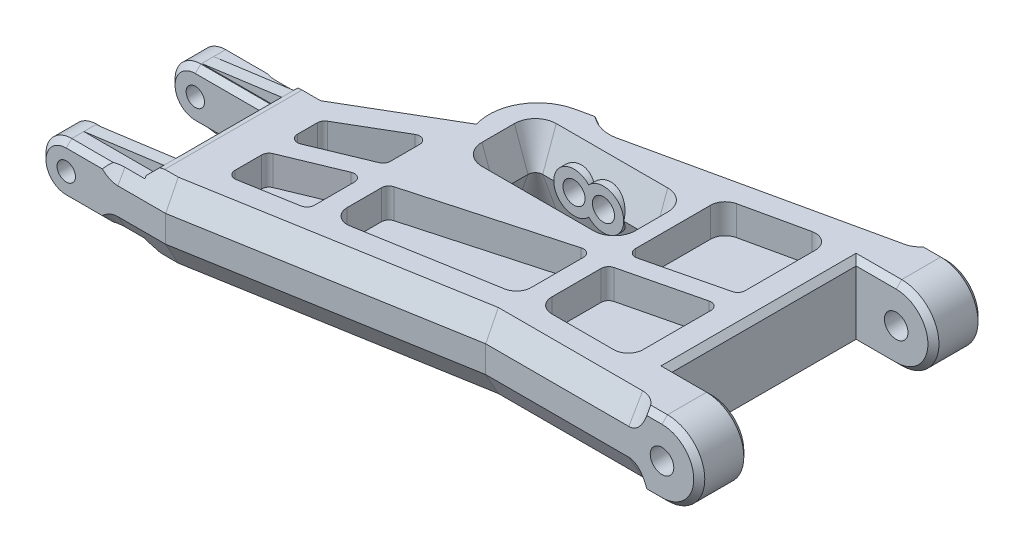
from build123d import *

# Parameters (mm, degrees)
BOSS_EXTRUDE1_DEPTH          = 22.5
SKETCH2_W                    = 5.44
SKETCH2_H                    = 25
SKETCH2_W_2                  = 5.06
SKETCH2_W_3                  = 14
SKETCH2_H_2                  = 12.66
CUT_EXTRUDE1_DEPTH           = 84.297406922
CUT_EXTRUDE2_DEPTH           = 4
CUT_EXTRUDE3_DEPTH           = 83.83506021
CUT_EXTRUDE3_TAPER           = -20
CUT_EXTRUDE3_OTHER_WAY_DEPTH = 83.83506021
CUT_EXTRUDE3_OTHER_WAY_TAPER = -20
SKETCH5_R                    = 1.25
CUT_EXTRUDE4_DEPTH           = 83.862278517
SKETCH6_R                    = 1.6
CUT_EXTRUDE5_DEPTH           = 92.544509398
CHAMFER1_SIZE                = 1.876388375
CHAMFER1_SIZE_2              = 3.25
CHAMFER4_SIZE                = 1.876388375
CHAMFER4_SIZE_2              = 3.25
SKETCH7_W                    = 13.2
SKETCH7_H                    = 1.292571429
CUT_EXTRUDE6_DEPTH           = 92.544509398
CHAMFER3_SIZE                = 1
CHAMFER3_SIZE2               = 1.187388498
BOSS_EXTRUDE2_REACH          = 90.574
BOSS_EXTRUDE3_REACH          = 93.545
FILLET1_R                    = 3
SKETCH10_R                   = 2.75
BOSS_EXTRUDE4_DEPTH          = 3.1
SKETCH11_R                   = 1.5
CUT_EXTRUDE7_DEPTH           = 5
BOSS_EXTRUDE5_REACH          = 85.297
FILLET2_R                    = 5
CUT_EXTRUDE8_DEPTH           = 5
EXTRUDE_THIN1_DEPTH          = 0.815
BOSS_EXTRUDE6_START          = -0.975722
BOSS_EXTRUDE6_DEPTH          = 0.975722
BOSS_EXTRUDE7_START          = -0.975722
BOSS_EXTRUDE7_DEPTH          = 0.975722
FILLET3_R                    = 5
FILLET4_R                    = 2
FILLET5_R                    = 1
CHAMFER5_SIZE                = 0.75
SKETCH20_R                   = 94.398541258
CUT_EXTRUDE10_DEPTH          = 83.835060221


with BuildPart() as part:
    # Sketch1 → Boss-Extrude1 (new, symmetric)
    with BuildSketch(Plane.XY):
        with BuildLine():
            Line((11.5, 5.06), (1, 3.5))
            Line((1, 3.5), (0, 3.5))
            ThreePointArc((0, 3.5), (-3.5, 0), (0, -3.5))
            Line((0, -3.5), (1, -3.5))
            Line((1, -3.5), (11.5, -5.06))
            Line((11.5, -5.06), (74.5, -5.06))
            ThreePointArc((74.5, -5.06), (79.56, 0), (74.5, 5.06))
            Line((74.5, 5.06), (11.5, 5.06))
        make_face()
    extrude(amount=BOSS_EXTRUDE1_DEPTH, both=True)

    # Sketch2 → Cut-Extrude1 (cut, through all)
    with BuildSketch(Plane(origin=(0, 5.06, 0), x_dir=(1, 0, 0), z_dir=(0, 1, 0))):
        with Locations((71.78, 3.2)):
            Rectangle(SKETCH2_W, SKETCH2_H)
        with Locations((77.03, 3.2)):
            Rectangle(SKETCH2_W_2, SKETCH2_H)
        with BuildLine():
            Line((13.5, -0.1), (27.06, 7.841716136))
            ThreePointArc((27.06, 7.841716136), (28.519247904, 11.985264581), (32.252932157, 14.3))
            Line((32.252932157, 14.3), (69.56, 22.5))
            Line((69.56, 22.5), (-4.3, 22.5))
            Line((-4.3, 22.5), (-4.3, -0.1))
            Line((-4.3, -0.1), (13.5, -0.1))
        make_face()
        with Locations((2.7, -11.3)):
            Rectangle(SKETCH2_W_3, SKETCH2_H_2)
        Polygon((79.56, -22.5), (13.5, -22.5), (50.56, -16.1), (79.56, -16.1), align=None)
    extrude(amount=-CUT_EXTRUDE1_DEPTH, mode=Mode.SUBTRACT)

    # Sketch3 → Cut-Extrude2 (cut)
    with BuildSketch(Plane(origin=(0, 5.06, 0), x_dir=(1, 0, 0), z_dir=(0, 1, 0))):
        Polygon((16.38, -17.182335448), (16.38, -11.682335448), (25.88, -7.741752609), (25.88, -15.541752609), align=None)
        Polygon((16.38, -4.207683605), (25.88, 1.356203069), (25.88, -5.03521245), (16.38, -8.975795289), align=None)
        Polygon((52.78, -11.35), (65.18, -11.35), (65.18, 1.15), (52.78, -1.85), align=None)
        Polygon((65.18, 16.540798611), (52.78, 13.815309693), (52.78, 0.722125554), (65.18, 3.722125554), align=None)
        Polygon((28.38, -15.110020283), (50.28, -11.328045108), (50.28, -1.228045108), (28.38, -7.310020283), align=None)
    extrude(amount=-CUT_EXTRUDE2_DEPTH, mode=Mode.SUBTRACT)

    # Sketch4 → Cut-Extrude3 (cut)
    with BuildSketch(Plane(origin=(0, 0, 0), x_dir=(1, 0, 0), z_dir=(0, 1, 0))):
        with BuildLine():
            ThreePointArc((32.7, 9.5), (31.992893219, 9.207106781), (31.7, 8.5))
            Line((31.7, 8.5), (31.7, 4.1))
            ThreePointArc((31.7, 4.1), (31.992893219, 3.392893219), (32.7, 3.1))
            Line((32.7, 3.1), (47.83, 3.1))
            ThreePointArc((47.83, 3.1), (48.537106781, 3.392893219), (48.83, 4.1))
            Line((48.83, 4.1), (48.83, 8.5))
            ThreePointArc((48.83, 8.5), (48.537106781, 9.207106781), (47.83, 9.5))
            Line((47.83, 9.5), (32.7, 9.5))
        make_face()
    extrude(amount=-CUT_EXTRUDE3_DEPTH, taper=CUT_EXTRUDE3_TAPER, mode=Mode.SUBTRACT)

    # Sketch4 → Cut-Extrude3 other way (cut)
    with BuildSketch(Plane(origin=(0, 0, 0), x_dir=(1, 0, 0), z_dir=(0, 1, 0))):
        with BuildLine():
            ThreePointArc((32.7, 9.5), (31.992893219, 9.207106781), (31.7, 8.5))
            Line((31.7, 8.5), (31.7, 4.1))
            ThreePointArc((31.7, 4.1), (31.992893219, 3.392893219), (32.7, 3.1))
            Line((32.7, 3.1), (47.83, 3.1))
            ThreePointArc((47.83, 3.1), (48.537106781, 3.392893219), (48.83, 4.1))
            Line((48.83, 4.1), (48.83, 8.5))
            ThreePointArc((48.83, 8.5), (48.537106781, 9.207106781), (47.83, 9.5))
            Line((47.83, 9.5), (32.7, 9.5))
        make_face()
    extrude(amount=CUT_EXTRUDE3_OTHER_WAY_DEPTH, taper=CUT_EXTRUDE3_OTHER_WAY_TAPER, mode=Mode.SUBTRACT)

    # Sketch5 → Cut-Extrude4 (cut, through all)
    with BuildSketch(Plane(origin=(0, 0, 0.1), x_dir=(-1, 0, 0), z_dir=(0, 0, -1))):
        Circle(SKETCH5_R)
    extrude(amount=-CUT_EXTRUDE4_DEPTH, mode=Mode.SUBTRACT)

    # Sketch6 → Cut-Extrude5 (cut, through all)
    with BuildSketch(Plane(origin=(0, 0, -22.5), x_dir=(-1, 0, 0), z_dir=(0, 0, -1))):
        with Locations((-74.5, 0)):
            Circle(SKETCH6_R)
    extrude(amount=-CUT_EXTRUDE5_DEPTH, mode=Mode.SUBTRACT)

    # Chamfer1
    # the kernel refuses this chamfer: 3.25, 1.876388375 mm, written as the material it takes off along each edge
    with BuildSketch(Plane(origin=(24.040928635, 5.06, -12.49502221), x_dir=(0.21467312424098708, 1.4200339837909367e-15, 0.9766859524579095), z_dir=(0.9766859524579095, 0, -0.21467312424098706))) as chamfer1_piece_1:
        Polygon((CHAMFER1_SIZE, 0), (0, CHAMFER1_SIZE_2), (0, 0), align=None)
    extrude(amount=60.899286206, mode=Mode.SUBTRACT)
    with BuildSketch(Plane(origin=(6.244719032, 5.06, 4.349216957), x_dir=(0.505376124050371, 2.840067967581874e-15, 0.862899167481244), z_dir=(0.862899167481244, 0, -0.5053761240503711))) as chamfer1_piece_2_section:
        Polygon((CHAMFER1_SIZE, 0), (0, CHAMFER1_SIZE_2), (0, 0), align=None)
    chamfer1_piece_2 = extrude(amount=32.530523835, mode=Mode.PRIVATE)
    chamfer1_piece_2 = chamfer1_piece_2 - Plane(origin=(33.672446762, 5.06, -7.841716136), x_dir=(-1, 0, 0), z_dir=(0, 1, 0)) * Cylinder(6.612446762, 79, mode=Mode.PRIVATE)
    chamfer1_piece_2 = split(chamfer1_piece_2, bisect_by=Plane(origin=(6.244719032, 6.087464915, 2.56959552), z_dir=(0, 0.5000000000000003, -0.8660254037844385)), keep=Keep.TOP, mode=Mode.PRIVATE)
    add(chamfer1_piece_2, mode=Mode.SUBTRACT)
    with BuildSketch(Plane(origin=(-13.724086108, 5.06, 0.1), x_dir=(0, 0, 1), z_dir=(1, 0, 0))) as chamfer1_piece_3_section:
        Polygon((CHAMFER1_SIZE, 0), (0, CHAMFER1_SIZE_2), (0, 0), align=None)
    chamfer1_piece_3 = extrude(amount=35.63211481, mode=Mode.PRIVATE)
    chamfer1_piece_3 = split(chamfer1_piece_3, bisect_by=Plane(origin=(-7.797998364, -1.710063308, 10.218436422), z_dir=(-0.4376685618937373, 0.4999999999999999, -0.7472925999432003)), keep=Keep.TOP, mode=Mode.PRIVATE)
    add(chamfer1_piece_3, mode=Mode.SUBTRACT)

    # Chamfer4
    # the kernel refuses this chamfer: 3.25, 1.876388375 mm, written as the material it takes off along each edge
    with BuildSketch(Plane(origin=(42.151971297, 5.06, 16.1), x_dir=(0, 0, -1), z_dir=(1, 0, 0))) as chamfer4_piece_1_section:
        Polygon((CHAMFER4_SIZE, 0), (0, -CHAMFER4_SIZE_2), (0, 0), align=None)
    chamfer4_piece_1 = extrude(amount=40.756057405, mode=Mode.PRIVATE)
    chamfer4_piece_1 = split(chamfer4_piece_1, bisect_by=Plane(origin=(42.095104214, 4.867066773, 15.770704047), z_dir=(0.14737503768376764, 0.5000000000000004, 0.8533935775875676)), keep=Keep.TOP, mode=Mode.PRIVATE)
    add(chamfer4_piece_1, mode=Mode.SUBTRACT)
    with BuildSketch(Plane(origin=(-0.585161969, 5.06, 24.932407895), x_dir=(-0.170174035357109, 2.3667233063182273e-15, -0.98541402348976), z_dir=(0.98541402348976, 0, -0.170174035357109))) as chamfer4_piece_2_section:
        Polygon((CHAMFER4_SIZE, 0), (0, -CHAMFER4_SIZE_2), (0, 0), align=None)
    chamfer4_piece_2 = extrude(amount=60.310235034, mode=Mode.PRIVATE)
    chamfer4_piece_2 = split(chamfer4_piece_2, bisect_by=Plane(origin=(-0.585161969, 0.422955193, 16.900810693), z_dir=(0, 0.5000000000000011, 0.866025403784438)), keep=Keep.TOP, mode=Mode.PRIVATE)
    add(chamfer4_piece_2, mode=Mode.SUBTRACT)
    with BuildSketch(Plane(origin=(27.793648794, 5.06, 22.5), x_dir=(0, 0, -1), z_dir=(-1, 0, 0))) as chamfer4_piece_3:
        Polygon((CHAMFER4_SIZE, 0), (0, CHAMFER4_SIZE_2), (0, 0), align=None)
    extrude(amount=41.517734902, mode=Mode.SUBTRACT)

    # Sketch7 → Cut-Extrude6 (cut, through all)
    with BuildSketch(Plane.XY.offset(22.5)):
        with Locations((3.1, 4.146285715)):
            Rectangle(SKETCH7_W, SKETCH7_H)
    extrude(amount=-CUT_EXTRUDE6_DEPTH, mode=Mode.SUBTRACT)

    # Chamfer3
    chamfer3_edges = [part.edges().sort_by_distance(p)[0] for p in [
        (9.7, 4.792571429, 11.3),
    ]]
    chamfer3_side = [part.faces().sort_by_distance(p)[0] for p in [
        (9.7, 0.287729181, 11.3),
    ]]
    chamfer(chamfer3_edges, length=CHAMFER3_SIZE, length2=CHAMFER3_SIZE2, reference=chamfer3_side[0])

    # Boss-Extrude2: up to this face of the body (flat: up to its plane)
    boss_extrude2_end = Plane(part.part.faces().sort_by_distance((64.226118544, 3.401483024, 15.181156848))[0])
    # Sketch8 → Boss-Extrude2 (add, up to the picked face)
    with BuildSketch(Plane.XY.offset(16.1), mode=Mode.PRIVATE) as boss_extrude2_sk1:
        with BuildLine():
            Line((73, 1.81), (79.225198409, 1.81))
            ThreePointArc((79.225198409, 1.81), (77.367490192, 4.169064643), (74.5, 5.06))
            Line((74.5, 5.06), (73, 5.06))
            Line((73, 5.06), (73, 1.81))
        make_face()
    boss_extrude2_tool1 = split(extrude(boss_extrude2_sk1.sketch, amount=-BOSS_EXTRUDE2_REACH, mode=Mode.PRIVATE), bisect_by=boss_extrude2_end, keep=Keep.BOTH, mode=Mode.PRIVATE)
    add(boss_extrude2_tool1.solids().sort_by(Axis((75.582426, 3.239563, 16.1), (0, 0, -1)))[0])

    # Boss-Extrude3: up to this face of the body (flat: up to its plane)
    boss_extrude3_end = Plane(part.part.faces().sort_by_distance((51.558145172, 3.49910555, -17.544753178))[0])
    # Sketch9 → Boss-Extrude3 (add, up to the picked face)
    with BuildSketch(Plane(origin=(0, 0, -22.5), x_dir=(-1, 0, 0), z_dir=(0, 0, -1)), mode=Mode.PRIVATE) as boss_extrude3_sk1:
        with BuildLine():
            Line((-76.805719419, 4.504137871), (-73, 3.089077168))
            Line((-73, 3.089077168), (-73, 5.06))
            Line((-73, 5.06), (-74.5, 5.06))
            ThreePointArc((-74.5, 5.06), (-75.685888353, 4.919071946), (-76.805719419, 4.504137871))
        make_face()
    boss_extrude3_tool1 = split(extrude(boss_extrude3_sk1.sketch, amount=-BOSS_EXTRUDE3_REACH, mode=Mode.PRIVATE), bisect_by=boss_extrude3_end, keep=Keep.BOTH, mode=Mode.PRIVATE)
    add(boss_extrude3_tool1.solids().sort_by(Axis((74.387172, 4.311631, -22.5), (0, 0, 1)))[0])

    # Fillet1
    # the kernel refuses this fillet: 3 mm, written as the material it adds along each edge
    with BuildSketch(Plane(origin=(73, 10.409266488, -18.172802231), x_dir=(-0.9825663271747567, -0.0946055110822194, 0.16004127584839264), z_dir=(0, -0.8608424927047637, -0.5088714992548207))) as fillet1_piece_1_section:
        with BuildLine():
            CenterArc((FILLET1_R * 0.828531976301, FILLET1_R), FILLET1_R, 190.714330728, 79.285669272)
            Line((-FILLET1_R * 0.154034350874, FILLET1_R * 0.814087620901), (0, 0))
            Line((0, 0), (FILLET1_R * 0.828531976301, 0))
        make_face()
    fillet1_piece_1 = extrude(amount=14.71750746, mode=Mode.PRIVATE)
    fillet1_piece_1 = split(fillet1_piece_1, bisect_by=Plane(origin=(73, 10.409266488, -22.5), z_dir=(0, 0, 1)), keep=Keep.TOP, mode=Mode.PRIVATE)
    fillet1_piece_1 = split(fillet1_piece_1, bisect_by=Plane(origin=(73, 5.06, -18.172802231), z_dir=(0, -1, 0)), keep=Keep.TOP, mode=Mode.PRIVATE)
    add(fillet1_piece_1)
    with BuildSketch(Plane(origin=(73, -4.685190528, 19.85), x_dir=(0, 0.5000000000267207, 0.8660254037690114), z_dir=(0, 0.8660254037690115, -0.5000000000267208))) as fillet1_piece_2_section:
        with BuildLine():
            CenterArc((FILLET1_R, -FILLET1_R), FILLET1_R, 90, 90)
            Line((0, -FILLET1_R), (0, 0))
            Line((0, 0), (FILLET1_R, 0))
        make_face()
    fillet1_piece_2 = extrude(amount=18.75277675, mode=Mode.PRIVATE)
    fillet1_piece_2 = split(fillet1_piece_2, bisect_by=Plane(origin=(73, -4.685190528, 16.1), z_dir=(0, 0, -1)), keep=Keep.TOP, mode=Mode.PRIVATE)
    fillet1_piece_2 = split(fillet1_piece_2, bisect_by=Plane(origin=(73, 5.06, 19.85), z_dir=(0, -1, 0)), keep=Keep.TOP, mode=Mode.PRIVATE)
    add(fillet1_piece_2)

    # Sketch10 → Boss-Extrude4 (add)
    with BuildSketch(Plane.XY):
        with Locations((36.951639785, 0)):
            Circle(SKETCH10_R)
        with Locations((40.951639785, 0)):
            Circle(SKETCH10_R)
    boss_extrude4 = extrude(amount=-BOSS_EXTRUDE4_DEPTH)

    # Sketch11 → Cut-Extrude7 (cut)
    with BuildSketch(Plane(origin=(0, 0, -3.1), x_dir=(-1, 0, 0), z_dir=(0, 0, -1))):
        with Locations((-36.951639785, 0)):
            Circle(SKETCH11_R)
        with Locations((-40.951639785, 0)):
            Circle(SKETCH11_R)
    cut_extrude7 = extrude(amount=-CUT_EXTRUDE7_DEPTH, mode=Mode.SUBTRACT)

    # Mirror2: Boss-Extrude4, Cut-Extrude7 across plane
    add(boss_extrude4.mirror(Plane(origin=(0, 0, -6.3), x_dir=(1, 0, 0), z_dir=(0, 0, -1))))
    add(cut_extrude7.mirror(Plane(origin=(0, 0, -6.3), x_dir=(1, 0, 0), z_dir=(0, 0, -1))), mode=Mode.SUBTRACT)

    # Boss-Extrude5: up to this face of the body (flat: up to its plane)
    boss_extrude5_end = Plane(part.part.faces().sort_by_distance((49.916496452, 3.457626238, -17.208442651))[0])
    # Sketch17 → Boss-Extrude5 (add, up to the picked face)
    with BuildSketch(Plane(origin=(0, 5.06, 0), x_dir=(1, 0, 0), z_dir=(0, 1, 0)), mode=Mode.PRIVATE) as boss_extrude5_sk1:
        with BuildLine():
            Line((33.632428264, 12.682030957), (33.229618109, 14.514673124))
            Line((33.229618109, 14.514673124), (32.252932157, 14.3))
            ThreePointArc((32.252932157, 14.3), (29.924819517, 13.289627865), (28.148762241, 11.47673491))
            Line((28.148762241, 11.47673491), (33.632428264, 12.682030957))
        make_face()
    boss_extrude5_tool1 = split(extrude(boss_extrude5_sk1.sketch, amount=-BOSS_EXTRUDE5_REACH, mode=Mode.PRIVATE), bisect_by=boss_extrude5_end, keep=Keep.BOTH, mode=Mode.PRIVATE)
    add(boss_extrude5_tool1.solids().sort_by(Axis((31.286541, 5.06, -12.988637), (0, -1, 0)))[0])

    # Fillet2
    # the kernel refuses this fillet: 5 mm, written as the material it adds along each edge
    with BuildSketch(Plane(origin=(31.887911083, -9.015317547, -20.618960327), x_dir=(0.9766859524579098, -1.874984630311798e-15, -0.21467312424098514), z_dir=(0.10733656212623062, 0.8660254037690109, 0.48834297625505346))) as fillet2_piece_1_section:
        with BuildLine():
            CenterArc((FILLET2_R, FILLET2_R), FILLET2_R, 180, 90)
            Line((0, FILLET2_R), (0, 0))
            Line((0, 0), (FILLET2_R, 0))
        make_face()
    fillet2_piece_1 = extrude(amount=28.75277675, mode=Mode.PRIVATE)
    fillet2_piece_1 = split(fillet2_piece_1, bisect_by=Plane(origin=(31.887911083, 5.06, -20.618960327), z_dir=(0, -1, 0)), keep=Keep.TOP, mode=Mode.PRIVATE)
    fillet2_piece_1 = split(fillet2_piece_1, bisect_by=Plane(origin=(33.229618109, -9.015317547, -14.514673124), z_dir=(0.21467312424098706, 0, 0.9766859524579095)), keep=Keep.TOP, mode=Mode.PRIVATE)
    add(fillet2_piece_1)

    # Sketch12 → Cut-Extrude8 (cut)
    with BuildSketch(Plane.XY.offset(-13.5)):
        with BuildLine():
            Line((36.951639785, 2.95), (40.951639785, 2.95))
            ThreePointArc((40.951639785, 2.95), (43.901639785, 0), (40.951639785, -2.95))
            Line((40.951639785, -2.95), (36.951639785, -2.95))
            ThreePointArc((36.951639785, -2.95), (34.001639785, 0), (36.951639785, 2.95))
        make_face()
    extrude(amount=-CUT_EXTRUDE8_DEPTH, mode=Mode.SUBTRACT)

    # Sketch13 → Extrude-Thin1 (add, symmetric)
    with BuildSketch(Plane.XY.offset(19.3)):
        Polygon((0, 3.5), (10.874496644, 4.967068073), (11.141892366, 2.985023793), (0.267395722, 1.51795572), align=None)
    extrude_thin1 = extrude(amount=EXTRUDE_THIN1_DEPTH, both=True)

    # Sketch18 → Boss-Extrude6 (add)
    with BuildSketch(Plane.XY.offset(22.5).offset(BOSS_EXTRUDE6_START)):
        with BuildLine():
            Line((2, 1.81), (2, 3.5))
            Line((2, 3.5), (0, 3.5))
            ThreePointArc((0, 3.5), (-1.719738352, 3.048360215), (-2.995646842, 1.81))
            Line((-2.995646842, 1.81), (2, 1.81))
        make_face()
    extrude(amount=BOSS_EXTRUDE6_DEPTH)

    # Sketch19 → Boss-Extrude7 (add)
    with BuildSketch(Plane(origin=(0, 0, 0.1), x_dir=(-1, 0, 0), z_dir=(0, 0, -1)).offset(BOSS_EXTRUDE7_START)):
        with BuildLine():
            Line((0, 3.5), (-2, 3.5))
            Line((-2, 3.5), (-2, 1.81))
            Line((-2, 1.81), (2.995646842, 1.81))
            ThreePointArc((2.995646842, 1.81), (1.719738352, 3.048360215), (0, 3.5))
        make_face()
    extrude(amount=BOSS_EXTRUDE7_DEPTH)

    # Fillet3
    # the kernel refuses this fillet: 5 mm, written as the material it adds along each edge
    with BuildSketch(Plane(origin=(2, 14.325317625, 15.274278), x_dir=(1, 0, 0), z_dir=(0, -0.8660254037690098, 0.5000000000267235))) as fillet3_piece_1_section:
        with BuildLine():
            CenterArc((FILLET3_R, FILLET3_R), FILLET3_R, 180, 90)
            Line((0, FILLET3_R), (0, 0))
            Line((0, 0), (FILLET3_R, 0))
        make_face()
    fillet3_piece_1 = extrude(amount=26.951444, mode=Mode.PRIVATE)
    fillet3_piece_1 = split(fillet3_piece_1, bisect_by=Plane(origin=(2, 3.5, 15.274278), z_dir=(0, -1, 0)), keep=Keep.TOP, mode=Mode.PRIVATE)
    fillet3_piece_1 = split(fillet3_piece_1, bisect_by=Plane(origin=(2, 14.325317625, 22.5), z_dir=(0, 0, -1)), keep=Keep.TOP, mode=Mode.PRIVATE)
    add(fillet3_piece_1)
    with BuildSketch(Plane(origin=(2, -9.015317547, -6.15), x_dir=(1, 0, 0), z_dir=(0, 0.8660254037690098, 0.5000000000267235))) as fillet3_piece_2_section:
        with BuildLine():
            CenterArc((FILLET3_R, FILLET3_R), FILLET3_R, 180, 90)
            Line((0, FILLET3_R), (0, 0))
            Line((0, 0), (FILLET3_R, 0))
        make_face()
    fillet3_piece_2 = extrude(amount=26.95144391, mode=Mode.PRIVATE)
    fillet3_piece_2 = split(fillet3_piece_2, bisect_by=Plane(origin=(2, 3.5, -6.15), z_dir=(0, -1, 0)), keep=Keep.TOP, mode=Mode.PRIVATE)
    fillet3_piece_2 = split(fillet3_piece_2, bisect_by=Plane(origin=(2, -9.015317547, 0.1), z_dir=(0, 0, 1)), keep=Keep.TOP, mode=Mode.PRIVATE)
    add(fillet3_piece_2)

    # Mirror3: Extrude-Thin1 across plane
    add(extrude_thin1.mirror(Plane.XY.offset(11.3)))

    # Fillet4
    fillet4_edges = [part.edges().sort_by_distance(p)[0] for p in [
        (52.78, 3.06, 11.35),
        (65.18, 3.06, 11.35),
        (65.18, 3.06, -16.540798611),
        (52.78, 3.06, -13.815309693),
        (50.28, 3.06, 11.328045108),
        (28.38, 3.06, 15.110020283),
    ]]
    fillet(fillet4_edges, radius=FILLET4_R)

    # Fillet5
    fillet5_edges = [part.edges().sort_by_distance(p)[0] for p in [
        (16.38, 3.06, 8.975795289),
        (16.38, 3.06, 4.207683605),
        (25.88, 3.06, -1.356203069),
        (25.88, 3.06, 5.03521245),
        (52.78, 3.06, 1.85),
        (65.18, 3.06, -1.15),
        (65.18, 3.06, -3.722125554),
        (52.78, 3.06, -0.722125554),
        (28.38, 3.06, 7.310020283),
        (50.28, 3.06, 1.228045108),
        (25.88, 3.06, 15.541752609),
        (16.38, 3.06, 17.182335448),
        (16.38, 3.06, 11.682335448),
        (25.88, 3.06, 7.741752609),
    ]]
    fillet(fillet5_edges, radius=FILLET5_R)

    # Chamfer5
    chamfer5_edges = [part.edges().sort_by_distance(p)[0] for p in [
        (71.78, -5.06, -15.7),
        (71.78, 5.06, 9.3),
        (71.78, 5.06, -15.7),
        (79.56, 0, -15.7),
        (79.56, 0, 9.3),
        (71.78, -5.06, 9.3),
        (69.06, 5.06, -3.2),
        (79.56, 0, -22.5),
        (73.583170563, 5.06, 16.1),
        (73.554008296, 5.06, -22.5),
        (72.03, -5.06, -22.5),
        (5.35, -4.146285714, 4.97),
        (5.35, -4.146285714, 17.63),
        (6.25, -4.28, 0.1),
        (2.109318962, 3.5, 22.5),
        (2.109318962, 3.5, 0.1),
        (-3.5, 0, 0.1),
        (-3.5, 0, 22.5),
        (0.5, -3.5, 0.1),
        (0.5, -3.5, 22.5),
        (4.85, 3.5, 17.63),
        (-3.5, 0, 17.63),
        (0.5, -3.5, 4.97),
        (0.5, -3.5, 17.63),
        (4.85, 3.5, 4.97),
        (-3.5, 0, 4.97),
        (6.25, -4.28, 22.5),
        (79.56, 0, 16.1),
        (62.53, -5.06, 16.1),
        (69.06, -5.06, -3.2),
    ]]
    chamfer(chamfer5_edges, length=CHAMFER5_SIZE)

    # Sketch20 → Cut-Extrude10 (cut, through all)
    with BuildSketch(Plane(origin=(0, 0, 0), x_dir=(1, 0, 0), z_dir=(0, 1, 0))):
        Circle(SKETCH20_R)
    extrude(amount=-CUT_EXTRUDE10_DEPTH, mode=Mode.SUBTRACT)

    # Mirror4: part across plane


with BuildPart() as part_1:
    add(part.part)
    add(part.part.mirror(Plane.ZX))


solid = part_1.part
